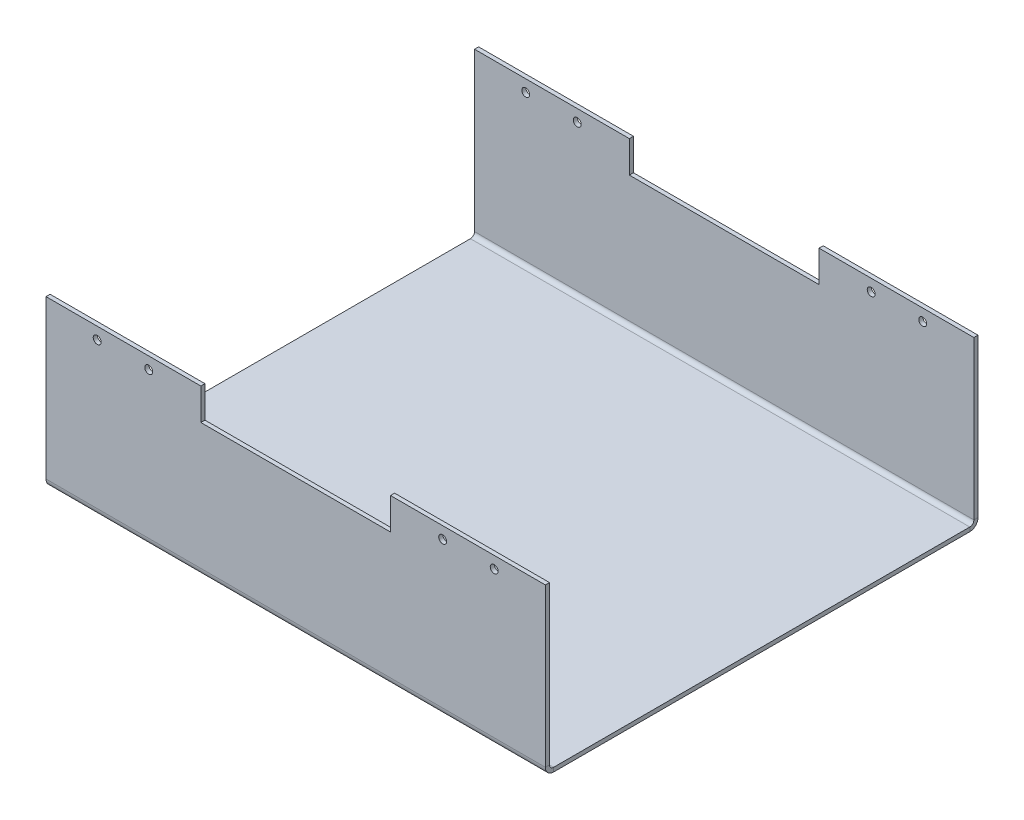
from build123d import *

# Parameters (mm, degrees)
BASE_FLANGE1_DEPTH         = 3.302
SKETCHED_START             = -200.64222
SKETCHED_BEND1_DEPTH       = 401.28444
SKETCHED_BEND1_2_DEPTH     = 401.28444
SKETCHED_BEND1_3_OUTLINE_W = 25.4
SKETCHED_BEND1_3_OUTLINE_H = 3.302
SKETCHED_BEND1_3_DEPTH     = 124.44222
SKETCHED_START_2           = 76.2
SKETCHED_BEND1_4_OUTLINE_W = 25.4
SKETCHED_BEND1_4_OUTLINE_H = 3.302
SKETCHED_BEND1_4_DEPTH     = 124.44222
SKETCH15_R                 = 3.175
EXTRUDE2_DEPTH             = 424.025832199


# Read off the part's stored shape, not the designer's step: Sketched Bend1
# Sheet-metal steps are written as plain solids
with BuildPart() as part:
    # Sketch2 → Base-Flange1 (new body)
    with BuildSketch(Plane(origin=(0, 0, 0), x_dir=(1, 0, 0), z_dir=(0, 1, 0))):
        Polygon((200.64222, -301.9242367), (200.64222, 301.9242367), (76.2, 301.9242367), (76.2, 276.5242367), (-76.2, 276.5242367), (-76.2, 301.9242367), (-200.64222, 301.9242367), (-200.64222, -301.9242367), (-76.2, -301.9242367), (-76.2, -276.5242367), (76.2, -276.5242367), (76.2, -301.9242367), align=None)
    extrude(amount=BASE_FLANGE1_DEPTH)

    # Sketched Bend1 outline → Sketched Bend1 (cut)
    with BuildSketch(Plane.YZ.offset(SKETCHED_START)):
        with BuildLine():
            ThreePointArc((0, 167.224159597), (0.884768233, 170.526159597), (3.302, 172.943391364))
            Line((3.302, 172.943391364), (3.302, 301.9242367))
            Line((3.302, 301.9242367), (0, 301.9242367))
            Line((0, 301.9242367), (0, 167.224159597))
        make_face()
        with BuildLine():
            ThreePointArc((3.302, -172.943391364), (0.884768233, -170.526159597), (0, -167.224159597))
            Line((0, -167.224159597), (0, -301.9242367))
            Line((0, -301.9242367), (3.302, -301.9242367))
            Line((3.302, -301.9242367), (3.302, -172.943391364))
        make_face()
    extrude(amount=SKETCHED_BEND1_DEPTH, mode=Mode.SUBTRACT)

    # Sketched Bend1 2 outline → Sketched Bend1 2 (add)
    with BuildSketch(Plane.YZ.offset(SKETCHED_START)):
        with BuildLine():
            ThreePointArc((3.302, 167.224159597), (4.269133409, 169.559026188), (6.604, 170.526159597))
            Line((6.604, 170.526159597), (108.123922897, 170.526159597))
            Line((108.123922897, 170.526159597), (108.123922897, 173.828159597))
            Line((108.123922897, 173.828159597), (6.604, 173.828159597))
            ThreePointArc((6.604, 173.828159597), (4.894759026, 173.603133754), (3.302, 172.943391364))
            Line((3.302, 172.943391364), (3.302, 167.224159597))
        make_face()
        with BuildLine():
            ThreePointArc((6.604, -170.526159597), (4.269133409, -169.559026188), (3.302, -167.224159597))
            Line((3.302, -167.224159597), (3.302, -172.943391364))
            ThreePointArc((3.302, -172.943391364), (4.894759026, -173.603133754), (6.604, -173.828159597))
            Line((6.604, -173.828159597), (108.123922897, -173.828159597))
            Line((108.123922897, -173.828159597), (108.123922897, -170.526159597))
            Line((108.123922897, -170.526159597), (6.604, -170.526159597))
        make_face()
    extrude(amount=SKETCHED_BEND1_2_DEPTH)

    # Sketched Bend1 3 outline → Sketched Bend1 3 (add)
    with BuildSketch(Plane.YZ.offset(SKETCHED_START)):
        with Locations((120.823922897, 172.177159597)):
            Rectangle(SKETCHED_BEND1_3_OUTLINE_W, SKETCHED_BEND1_3_OUTLINE_H)
        with Locations((120.823922897, -172.177159597)):
            Rectangle(SKETCHED_BEND1_3_OUTLINE_W, SKETCHED_BEND1_3_OUTLINE_H)
    extrude(amount=SKETCHED_BEND1_3_DEPTH)

    # Sketched Bend1 4 outline → Sketched Bend1 4 (add)
    with BuildSketch(Plane.YZ.offset(SKETCHED_START_2)):
        with Locations((120.823922897, 172.177159597)):
            Rectangle(SKETCHED_BEND1_4_OUTLINE_W, SKETCHED_BEND1_4_OUTLINE_H)
        with Locations((120.823922897, -172.177159597)):
            Rectangle(SKETCHED_BEND1_4_OUTLINE_W, SKETCHED_BEND1_4_OUTLINE_H)
    extrude(amount=SKETCHED_BEND1_4_DEPTH)

    # Sketch15 → Extrude2 (cut, through all)
    with BuildSketch(Plane.XY.offset(173.828159597)):
        with Locations((-159.512, 123.998922897)):
            Circle(SKETCH15_R)
        with Locations((-118.11, 123.998922897)):
            Circle(SKETCH15_R)
        with Locations(Location((118.11, 123.998922897, 0), (0, 0, 270))):
            Circle(SKETCH15_R)
        with Locations(Location((159.512, 123.998922897, 0), (0, 0, 270))):
            Circle(SKETCH15_R)
    extrude(amount=-EXTRUDE2_DEPTH, mode=Mode.SUBTRACT)


solid = part.part
